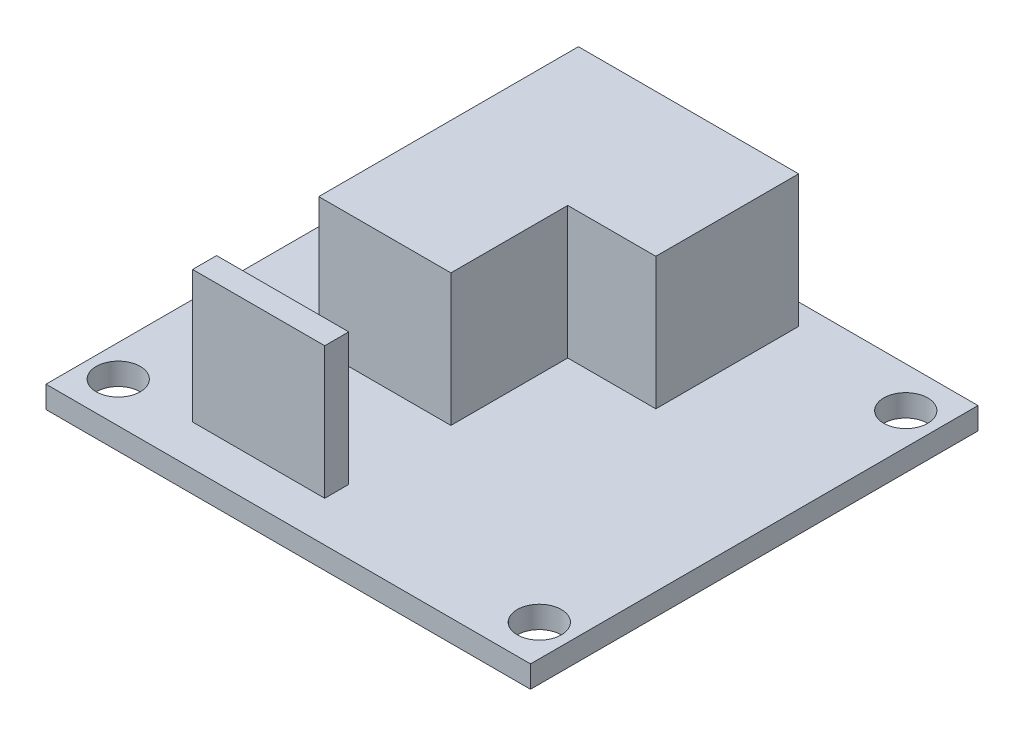
from build123d import *

# Parameters (mm, degrees)
SKETCH2_W             = 34.925
SKETCH2_H             = 32.258
SKETCH2_R             = 1.5875
SKETCH2_W_2           = 9.525
SKETCH2_H_2           = 1.73056427
BOSS_EXTRUDE1_DEPTH   = 1.5875
SKETCH3_W             = 9.525
SKETCH3_H             = 1.73056427
BOSS_EXTRUDE2_DEPTH   = 9.525
BOSS_EXTRUDE2_2_DEPTH = 9.525


with BuildPart() as part:
    # Sketch2 → Boss-Extrude1 (new body)
    with BuildSketch(Plane(origin=(0, 0, 0), x_dir=(1, 0, 0), z_dir=(0, 1, 0))):
        Rectangle(SKETCH2_W, SKETCH2_H)
        with Locations((-15.1765, -13.208)):
            Circle(SKETCH2_R, mode=Mode.SUBTRACT)
        with Locations((-5.054257583, -12.342717865)):
            Rectangle(SKETCH2_W_2, SKETCH2_H_2, mode=Mode.SUBTRACT)
        with Locations((15.1765, -13.208)):
            Circle(SKETCH2_R, mode=Mode.SUBTRACT)
        Polygon((-9.816757583, -4.112709283), (-9.816757583, 14.603812005), (-0.291757583, 14.603812005), (6.058242417, 14.603812005), (6.058242417, 4.309725297), (-0.291757583, 4.309725297), (-0.291757583, -4.112709283), align=None, mode=Mode.SUBTRACT)
        with Locations((-15.1765, 13.208)):
            Circle(SKETCH2_R, mode=Mode.SUBTRACT)
        with Locations((15.1765, 13.208)):
            Circle(SKETCH2_R, mode=Mode.SUBTRACT)
    extrude(amount=BOSS_EXTRUDE1_DEPTH)


with BuildPart() as body_2:
    # Sketch3 → Boss-Extrude2 (new body)
    with BuildSketch(Plane(origin=(0, 1.5875, 0), x_dir=(1, 0, 0), z_dir=(0, 1, 0))):
        with Locations((-5.054257583, -12.342717865)):
            Rectangle(SKETCH3_W, SKETCH3_H)
    extrude(amount=BOSS_EXTRUDE2_DEPTH)


with BuildPart() as body_3:
    # Sketch3 → Boss-Extrude2 2 (new body)
    with BuildSketch(Plane(origin=(0, 1.5875, 0), x_dir=(1, 0, 0), z_dir=(0, 1, 0))):
        Polygon((6.058242417, 4.309725297), (6.058242417, 14.603812005), (-9.816757583, 14.603812005), (-9.816757583, -4.112709283), (-0.291757583, -4.112709283), (-0.291757583, 4.309725297), align=None)
    extrude(amount=BOSS_EXTRUDE2_2_DEPTH)


solid = Compound([part.part, body_2.part, body_3.part])
